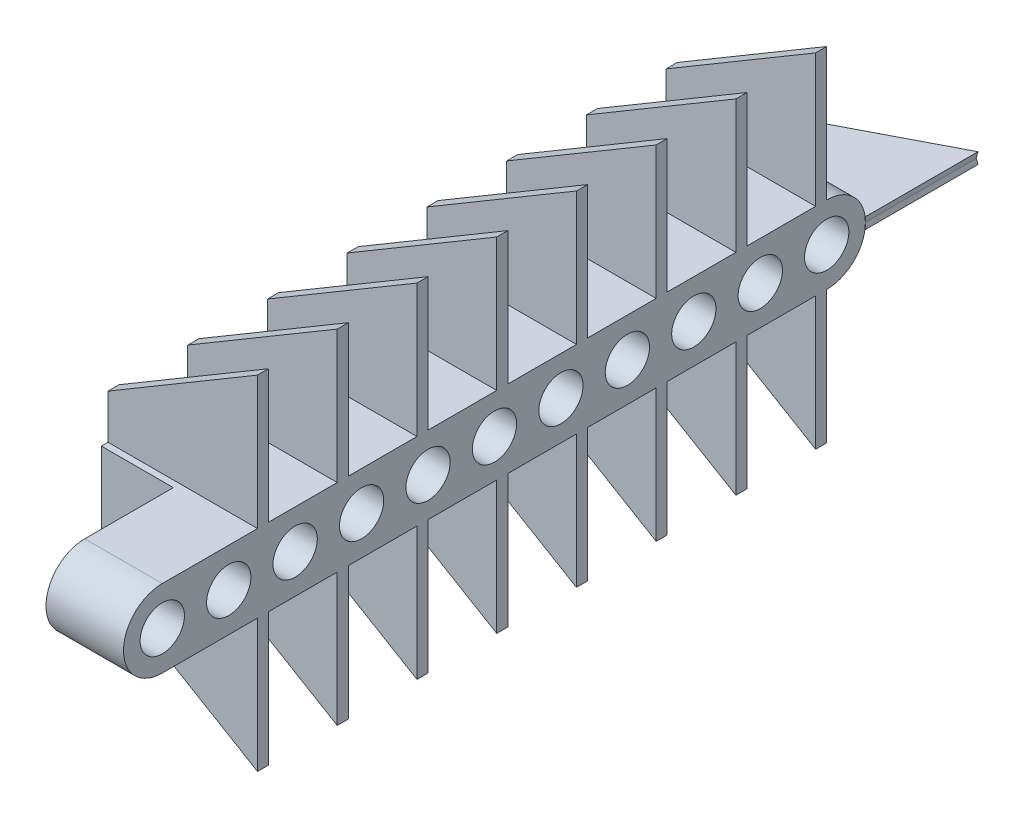
from build123d import *
from build123d.topology import SkipClean

# Parameters (mm, degrees)
SKETCH1_R                     = 20
BOSS_EXTRUDE1_DEPTH           = 70
BOSS_EXTRUDE2_START           = 65
SKETCH2_R                     = 20
BOSS_EXTRUDE2_DEPTH           = 65
SKETCH3_W                     = 10
SKETCH3_H                     = 120
BOSS_EXTRUDE3_DEPTH           = 135
CUT_EXTRUDE1_DEPTH            = 658.381167969
LPATTERN1_COUNT               = 8
LPATTERN1_PITCH               = 72
MIRROR1_DEPTH                 = 10
MIRROR1_START                 = 72
MIRROR1_2_DEPTH               = 10
MIRROR1_START_2               = 144
MIRROR1_3_DEPTH               = 10
MIRROR1_START_3               = 216
MIRROR1_4_DEPTH               = 10
MIRROR1_START_4               = 288
MIRROR1_5_DEPTH               = 10
MIRROR1_START_5               = 360
MIRROR1_6_DEPTH               = 10
MIRROR1_START_6               = 432
MIRROR1_7_DEPTH               = 10
MIRROR1_START_7               = 504
MIRROR1_8_DEPTH               = 10
BOSS_EXTRUDE4_DEPTH           = 5
BOSS_EXTRUDE4_TAPER           = -7
BOSS_EXTRUDE4_OTHER_WAY_DEPTH = 5
BOSS_EXTRUDE4_OTHER_WAY_TAPER = -7


# Read off the part's stored shape, not the designer's step: Mirror1
with BuildPart() as part:
    # Sketch1 → Boss-Extrude1 (new body)
    with BuildSketch(Plane(origin=(0, 0, 0), x_dir=(0, 0, -1), z_dir=(1, 0, 0))):
        with BuildLine():
            Line((0, -35), (-600, -35))
            ThreePointArc((-600, -35), (-635, 0), (-600, 35))
            Line((-600, 35), (0, 35))
            ThreePointArc((0, 35), (35, 0), (0, -35))
        make_face()
        with Locations((-600, 0)):
            Circle(SKETCH1_R, mode=Mode.SUBTRACT)
        with Locations((-540, 0)):
            Circle(SKETCH1_R, mode=Mode.SUBTRACT)
        with Locations((-480, 0)):
            Circle(SKETCH1_R, mode=Mode.SUBTRACT)
        with Locations((-420, 0)):
            Circle(SKETCH1_R, mode=Mode.SUBTRACT)
        with Locations((-360, 0)):
            Circle(SKETCH1_R, mode=Mode.SUBTRACT)
        with Locations((-300, 0)):
            Circle(SKETCH1_R, mode=Mode.SUBTRACT)
        with Locations((-240, 0)):
            Circle(SKETCH1_R, mode=Mode.SUBTRACT)
        with Locations((-180, 0)):
            Circle(SKETCH1_R, mode=Mode.SUBTRACT)
        with Locations((-120, 0)):
            Circle(SKETCH1_R, mode=Mode.SUBTRACT)
        with Locations((-60, 0)):
            Circle(SKETCH1_R, mode=Mode.SUBTRACT)
        Circle(SKETCH1_R, mode=Mode.SUBTRACT)
    extrude(amount=BOSS_EXTRUDE1_DEPTH)

    # Sketch2 → Boss-Extrude2 (add)
    with SkipClean():  # the faces are left unmerged after this step: merging them gives an invalid solid
        with BuildSketch(Plane.ZY.offset(BOSS_EXTRUDE2_START)):
            with BuildLine():
                Line((520, -35), (0, -35))
                ThreePointArc((0, -35), (-35, 0), (0, 35))
                Line((0, 35), (520, 35))
                Line((520, 35), (520, -35))
            make_face()
            with Locations((480, 0)):
                Circle(SKETCH2_R, mode=Mode.SUBTRACT)
            with Locations((420, 0)):
                Circle(SKETCH2_R, mode=Mode.SUBTRACT)
            with Locations((360, 0)):
                Circle(SKETCH2_R, mode=Mode.SUBTRACT)
            with Locations((300, 0)):
                Circle(SKETCH2_R, mode=Mode.SUBTRACT)
            with Locations((240, 0)):
                Circle(SKETCH2_R, mode=Mode.SUBTRACT)
            with Locations((180, 0)):
                Circle(SKETCH2_R, mode=Mode.SUBTRACT)
            with Locations((120, 0)):
                Circle(SKETCH2_R, mode=Mode.SUBTRACT)
            with Locations((60, 0)):
                Circle(SKETCH2_R, mode=Mode.SUBTRACT)
            Circle(SKETCH2_R, mode=Mode.SUBTRACT)
        extrude(amount=-BOSS_EXTRUDE2_DEPTH)

    # Sketch3 → Boss-Extrude3 (add)
    with SkipClean():  # the faces are left unmerged after this step: merging them gives an invalid solid
        with BuildSketch(Plane.ZY.offset(65)):
            with Locations((5, 95)):
                Rectangle(SKETCH3_W, SKETCH3_H)
        boss_extrude3 = extrude(amount=-BOSS_EXTRUDE3_DEPTH)

    # Sketch4 → Cut-Extrude1 (cut, through all)
    with SkipClean():  # the faces are left unmerged after this step: merging them gives an invalid solid
        with BuildSketch(Plane(origin=(0, 0, 0), x_dir=(-1, 0, 0), z_dir=(0, 0, -1))):
            Polygon((-70, 155), (65, 75), (65, 155), align=None)
        cut_extrude1 = extrude(amount=-CUT_EXTRUDE1_DEPTH, mode=Mode.SUBTRACT)

    # LPattern1: Boss-Extrude3, Cut-Extrude1 ×8
    with SkipClean():  # the faces are left unmerged after this step: merging them gives an invalid solid
        with Locations(*[(0, 0, i * LPATTERN1_PITCH) for i in range(1, LPATTERN1_COUNT)]):
            add(boss_extrude3)
            add(cut_extrude1, mode=Mode.SUBTRACT)

    # Mirror1 outline → Mirror1 (add)
    with SkipClean():  # the faces are left unmerged after this step: merging them gives an invalid solid
        with BuildSketch(Plane.XY):
            Polygon((70, -35), (-65, -35), (-65, -75), (70, -155), align=None)
        extrude(amount=MIRROR1_DEPTH)

    # Mirror1 2 outline → Mirror1 2 (add)
    with SkipClean():  # the faces are left unmerged after this step: merging them gives an invalid solid
        with BuildSketch(Plane.XY.offset(MIRROR1_START)):
            Polygon((70, -35), (-65, -35), (-65, -75), (70, -155), align=None)
        extrude(amount=MIRROR1_2_DEPTH)

    # Mirror1 3 outline → Mirror1 3 (add)
    with SkipClean():  # the faces are left unmerged after this step: merging them gives an invalid solid
        with BuildSketch(Plane.XY.offset(MIRROR1_START_2)):
            Polygon((70, -35), (-65, -35), (-65, -75), (70, -155), align=None)
        extrude(amount=MIRROR1_3_DEPTH)

    # Mirror1 4 outline → Mirror1 4 (add)
    with SkipClean():  # the faces are left unmerged after this step: merging them gives an invalid solid
        with BuildSketch(Plane.XY.offset(MIRROR1_START_3)):
            Polygon((70, -35), (-65, -35), (-65, -75), (70, -155), align=None)
        extrude(amount=MIRROR1_4_DEPTH)

    # Mirror1 5 outline → Mirror1 5 (add)
    with SkipClean():  # the faces are left unmerged after this step: merging them gives an invalid solid
        with BuildSketch(Plane.XY.offset(MIRROR1_START_4)):
            Polygon((70, -35), (-65, -35), (-65, -75), (70, -155), align=None)
        extrude(amount=MIRROR1_5_DEPTH)

    # Mirror1 6 outline → Mirror1 6 (add)
    with SkipClean():  # the faces are left unmerged after this step: merging them gives an invalid solid
        with BuildSketch(Plane.XY.offset(MIRROR1_START_5)):
            Polygon((70, -35), (-65, -35), (-65, -75), (70, -155), align=None)
        extrude(amount=MIRROR1_6_DEPTH)

    # Mirror1 7 outline → Mirror1 7 (add)
    with SkipClean():  # the faces are left unmerged after this step: merging them gives an invalid solid
        with BuildSketch(Plane.XY.offset(MIRROR1_START_6)):
            Polygon((70, -35), (-65, -35), (-65, -75), (70, -155), align=None)
        extrude(amount=MIRROR1_7_DEPTH)

    # Mirror1 8 outline → Mirror1 8 (add)
    with SkipClean():  # the faces are left unmerged after this step: merging them gives an invalid solid
        with BuildSketch(Plane.XY.offset(MIRROR1_START_7)):
            Polygon((70, -35), (-65, -35), (-65, -75), (70, -155), align=None)
        extrude(amount=MIRROR1_8_DEPTH)


with BuildPart() as body_2:
    # Sketch5 → Boss-Extrude4 (new body)
    with BuildSketch(Plane(origin=(0, 0, 0), x_dir=(1, 0, 0), z_dir=(0, 1, 0))):
        Polygon((-65, 35), (70, 35), (70, 135), (-65, 65), align=None)
    extrude(amount=BOSS_EXTRUDE4_DEPTH, taper=BOSS_EXTRUDE4_TAPER)

    # Sketch5 → Boss-Extrude4 other way (add)
    with BuildSketch(Plane(origin=(0, 0, 0), x_dir=(1, 0, 0), z_dir=(0, 1, 0))):
        Polygon((-65, 35), (70, 35), (70, 135), (-65, 65), align=None)
    extrude(amount=-BOSS_EXTRUDE4_OTHER_WAY_DEPTH, taper=BOSS_EXTRUDE4_OTHER_WAY_TAPER)


solid = Compound([part.part, body_2.part])
